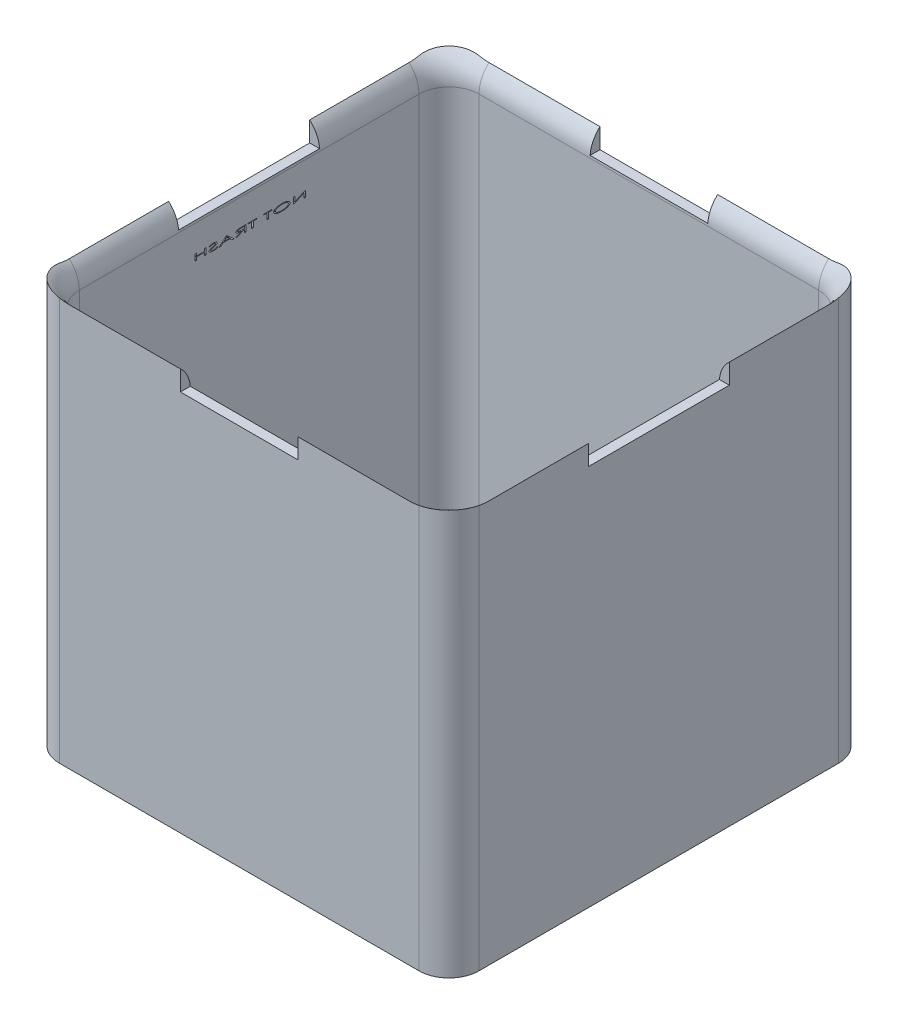
from build123d import *

# Parameters (mm, degrees)
SKETCH1_W           = 200
SKETCH1_H           = 200
BOSS_EXTRUDE1_DEPTH = 5
BOSS_EXTRUDE2_DEPTH = 205
FILLET1_R           = 15
FILLET2_R           = 15
CUT_EXTRUDE1_DEPTH  = 59
SKETCH5_W           = 70.571311495
SKETCH5_H           = 10
CUT_EXTRUDE2_DEPTH  = 241
SKETCH6_W           = 58.885242749
SKETCH6_H           = 10
CUT_EXTRUDE3_DEPTH  = 241


with BuildPart() as part:
    # Sketch1 → Boss-Extrude1 (new body)
    with BuildSketch(Plane(origin=(0, 0, 0), x_dir=(1, 0, 0), z_dir=(0, 1, 0))):
        Polygon((-75.900692841, 116.778290993), (-70.900692841, 111.778290993), (-70.900692841, -88.221709007), (-75.900692841, -93.221709007), align=None)
        Polygon((-75.900692841, -93.221709007), (134.099307159, -93.221709007), (129.099307159, -88.221709007), (-70.900692841, -88.221709007), align=None)
        Polygon((-75.900692841, 116.778290993), (134.099307159, 116.778290993), (134.099307159, -93.221709007), (129.099307159, -88.221709007), (129.099307159, 111.778290993), (-70.900692841, 111.778290993), align=None)
        with Locations((29.099307159, 11.778290993)):
            Rectangle(SKETCH1_W, SKETCH1_H)
    extrude(amount=BOSS_EXTRUDE1_DEPTH)

    # Sketch1<3> → Boss-Extrude2 (add)
    with BuildSketch(Plane(origin=(0, 0, 0), x_dir=(1, 0, 0), z_dir=(0, 1, 0))):
        Polygon((-75.900692841, 116.778290993), (-70.900692841, 111.778290993), (-70.900692841, -88.221709007), (-75.900692841, -93.221709007), align=None)
        Polygon((-75.900692841, 116.778290993), (134.099307159, 116.778290993), (134.099307159, -93.221709007), (129.099307159, -88.221709007), (129.099307159, 111.778290993), (-70.900692841, 111.778290993), align=None)
        Polygon((-75.900692841, -93.221709007), (134.099307159, -93.221709007), (129.099307159, -88.221709007), (-70.900692841, -88.221709007), align=None)
    extrude(amount=BOSS_EXTRUDE2_DEPTH)

    # Fillet1
    fillet1_edges = [part.edges().sort_by_distance(p)[0] for p in [
        (129.099307159, 105, -111.778290993),
        (129.099307159, 105, 88.221709007),
        (-70.900692841, 105, 88.221709007),
        (-70.900692841, 105, -111.778290993),
        (-75.900692841, 102.5, 93.221709007),
        (-75.900692841, 102.5, -116.778290993),
        (134.099307159, 102.5, -116.778290993),
        (134.099307159, 102.5, 93.221709007),
    ]]
    fillet(fillet1_edges, radius=FILLET1_R)

    # Fillet2
    # the kernel refuses this fillet: 15 mm, written as the material it takes off along each edge
    with BuildSketch(Plane(origin=(-55.900692841, 205, -96.778290993), x_dir=(0, 0, -1), z_dir=(1, 0, 0))) as fillet2_piece_1:
        with BuildLine():
            CenterArc((15 + FILLET2_R, -FILLET2_R), FILLET2_R, 90, 90)
            Line((15, -FILLET2_R), (15, 0))
            Line((15, 0), (15 + FILLET2_R, 0))
        make_face()
    revolve(axis=Axis((-55.900692841, 205, -96.778290993), (0, 1, 0)), revolution_arc=90, mode=Mode.SUBTRACT)
    with BuildSketch(Plane(origin=(114.099307159, 205, -111.778290993), x_dir=(0, 0, -1), z_dir=(-1, 0, 0)), Plane(origin=(129.099307159, 205, 73.221709007), x_dir=(1, 0, 0), z_dir=(0, 0, -1)), Plane(origin=(-70.900692841, 205, -96.778290993), x_dir=(-1, 0, 0), z_dir=(0, 0, 1))) as fillet2_piece_2:
        with BuildLine():
            CenterArc((FILLET2_R, FILLET2_R), FILLET2_R, 180, 90)
            Line((0, FILLET2_R), (0, 0))
            Line((0, 0), (FILLET2_R, 0))
        make_face()
    extrude(amount=170, mode=Mode.SUBTRACT)
    with BuildSketch(Plane(origin=(114.099307159, 205, -96.778290993), x_dir=(0, 0, -1), z_dir=(-1, 0, 0))) as fillet2_piece_3:
        with BuildLine():
            CenterArc((15 + FILLET2_R, FILLET2_R), FILLET2_R, 180, 90)
            Line((15, FILLET2_R), (15, 0))
            Line((15, 0), (15 + FILLET2_R, 0))
        make_face()
    revolve(axis=Axis((114.099307159, 205, -96.778290993), (0, -1, 0)), revolution_arc=90, mode=Mode.SUBTRACT)
    with BuildSketch(Plane(origin=(114.099307159, 205, 73.221709007), x_dir=(1, 0, 0), z_dir=(0, 0, -1))) as fillet2_piece_4:
        with BuildLine():
            CenterArc((15 + FILLET2_R, FILLET2_R), FILLET2_R, 180, 90)
            Line((15, FILLET2_R), (15, 0))
            Line((15, 0), (15 + FILLET2_R, 0))
        make_face()
    revolve(axis=Axis((114.099307159, 205, 73.221709007), (0, -1, 0)), revolution_arc=90, mode=Mode.SUBTRACT)
    with BuildSketch(Plane(origin=(114.099307159, 205, 88.221709007), x_dir=(0, 0, 1), z_dir=(-1, 0, 0))) as fillet2_piece_5:
        with BuildLine():
            CenterArc((FILLET2_R, -FILLET2_R), FILLET2_R, 90, 90)
            Line((0, -FILLET2_R), (0, 0))
            Line((0, 0), (FILLET2_R, 0))
        make_face()
    extrude(amount=170, mode=Mode.SUBTRACT)
    with BuildSketch(Plane(origin=(-55.900692841, 205, 73.221709007), x_dir=(0, 0, 1), z_dir=(1, 0, 0))) as fillet2_piece_6:
        with BuildLine():
            CenterArc((15 + FILLET2_R, FILLET2_R), FILLET2_R, 180, 90)
            Line((15, FILLET2_R), (15, 0))
            Line((15, 0), (15 + FILLET2_R, 0))
        make_face()
    revolve(axis=Axis((-55.900692841, 205, 73.221709007), (0, -1, 0)), revolution_arc=90, mode=Mode.SUBTRACT)

    # Sketch3 → Cut-Extrude1 (cut)
    # profile 1 of 8: a face of its own
    with BuildSketch(Plane.ZY.offset(75.900692841)):
        Polygon((-40.001857897, 173.592317805), (-40.001857897, 176.767317805), (-39.839037385, 176.767317805), (-34.628780974, 174.348542765), (-34.628780974, 176.767317805), (-33.855383538, 176.767317805), (-33.855383538, 173.592317805), (-34.031560422, 173.592317805), (-39.228460462, 176.004732669), (-39.228460462, 173.592317805), align=None)
    # profile 2 of 8: a face of its own
    with BuildSketch(Plane.ZY.offset(75.900692841)):
        with BuildLine():
            add(Edge.make_bspline(
                [(-28.206910982, 176.848728062), (-28.133765571, 176.848362168), (-27.988936169, 176.847637692), (-27.774131042, 176.841849515), (-27.563815377, 176.832059611), (-27.35806877, 176.819864911), (-27.15685382, 176.80248585), (-26.960116158, 176.781342181), (-26.767728325, 176.75744085), (-26.579758455, 176.729669701), (-26.396676198, 176.696833279), (-26.217993175, 176.661620999), (-26.043919432, 176.621964097), (-25.874219987, 176.578845755), (-25.708943301, 176.531938234), (-25.548249957, 176.480799304), (-25.392014548, 176.426431484), (-25.241309619, 176.368032014), (-25.097384802, 176.307409836), (-24.962068632, 176.244546513), (-24.835706384, 176.180296306), (-24.718682132, 176.114579652), (-24.611357936, 176.04625388), (-24.513385999, 175.97626215), (-24.423899021, 175.90528829), (-24.344106923, 175.832037768), (-24.273676004, 175.756952951), (-24.213179309, 175.679668479), (-24.161019899, 175.601330054), (-24.118707299, 175.520800668), (-24.086124085, 175.43820001), (-24.062465517, 175.354080034), (-24.047832536, 175.26810063), (-24.04624529, 175.210191359), (-24.045447641, 175.18108984)],
                knots=[0, 0, 0, 0, 1.460257546, 2.891339648, 4.289497073, 5.663427684, 7.005761575, 8.321032018, 9.613516541, 10.875907203, 12.113823443, 13.326535202, 14.511422874, 15.677566445, 16.821712134, 17.940750455, 19.043729357, 20.123697942, 21.166853829, 22.160988997, 23.101750196, 23.996314662, 24.839341628, 25.640341572, 26.399170546, 27.118067848, 27.800848129, 28.451961142, 29.075299312, 29.677322686, 30.264432108, 30.844651183, 31.419395126, 32, 32, 32, 32], degree=3))
            add(Edge.make_bspline(
                [(-24.045447641, 175.18108984), (-24.046245389, 175.152200016), (-24.047832842, 175.094711589), (-24.062465784, 175.009362743), (-24.086136445, 174.925883691), (-24.118685349, 174.843890054), (-24.161237029, 174.763945397), (-24.212921744, 174.685699443), (-24.273951602, 174.609253563), (-24.343350697, 174.533636679), (-24.423513471, 174.461058153), (-24.511681994, 174.38868647), (-24.610564438, 174.320009623), (-24.716998723, 174.250698076), (-24.834290984, 174.18518121), (-24.959641662, 174.119384267), (-25.09515935, 174.05670368), (-25.238586221, 173.995543993), (-25.388510319, 173.936315283), (-25.543930561, 173.882231768), (-25.702883414, 173.830090508), (-25.866503577, 173.783623079), (-26.033711266, 173.739534124), (-26.204989358, 173.699226279), (-26.380768462, 173.664058623), (-26.560521087, 173.631422168), (-26.744408455, 173.602972876), (-26.932029793, 173.577902527), (-27.123825406, 173.558003568), (-27.319712341, 173.540578418), (-27.519900545, 173.527352395), (-27.724099985, 173.517873056), (-27.932328356, 173.5119768), (-28.072495376, 173.511266434), (-28.14330922, 173.510907549)],
                knots=[0, 0, 0, 0, 0.584140325, 1.162392244, 1.746296282, 2.337325662, 2.9436603, 3.575393273, 4.231906634, 4.920964509, 5.649543557, 6.417945807, 7.227247536, 8.083939908, 8.98682013, 9.944179777, 10.947815242, 12.006697977, 13.098770757, 14.208509301, 15.335759188, 16.482942188, 17.649252518, 18.8343427, 20.042360184, 21.275834938, 22.530430142, 23.806834395, 25.10524114, 26.431464932, 27.785647702, 29.164070497, 30.567258786, 32, 32, 32, 32], degree=3))
            add(Edge.make_bspline(
                [(-28.14330922, 173.510907549), (-28.214971193, 173.511265208), (-28.356834189, 173.511973234), (-28.567392176, 173.517883303), (-28.773720738, 173.527266784), (-28.975973294, 173.540910983), (-29.174113355, 173.556887517), (-29.367898731, 173.578133295), (-29.557207493, 173.603073881), (-29.742695129, 173.630590605), (-29.923642789, 173.663494039), (-30.10072405, 173.698513375), (-30.273141431, 173.739127501), (-30.441659401, 173.782048362), (-30.605969554, 173.828899551), (-30.765604453, 173.880895442), (-30.92149669, 173.93519563), (-31.072033337, 173.993489555), (-31.21590786, 174.054207107), (-31.351482988, 174.116785155), (-31.477246931, 174.182159705), (-31.594873954, 174.246777732), (-31.701767323, 174.315387595), (-31.799900058, 174.384660489), (-31.889462863, 174.454706244), (-31.968346804, 174.528024566), (-32.039684888, 174.601124873), (-32.100075705, 174.677449405), (-32.152312114, 174.754449417), (-32.194446594, 174.833578985), (-32.227214692, 174.914399476), (-32.250852883, 174.996631413), (-32.265500695, 175.080710251), (-32.267086588, 175.137358352), (-32.267883538, 175.165825417)],
                knots=[0, 0, 0, 0, 1.445325035, 2.861184648, 4.248073488, 5.610784469, 6.949502363, 8.257024759, 9.542121152, 10.800563395, 12.038564666, 13.251154028, 14.440834281, 15.610669576, 16.758343651, 17.88610641, 18.996378223, 20.087438883, 21.141308751, 22.14565442, 23.098028525, 23.999684505, 24.85136998, 25.658118948, 26.422077793, 27.142316893, 27.828828533, 28.479923945, 29.102539741, 29.70318392, 30.284413152, 30.85825019, 31.426242623, 32, 32, 32, 32], degree=3))
            add(Edge.make_bspline(
                [(-32.267883538, 175.165825417), (-32.266339268, 175.203705852), (-32.263241734, 175.279687274), (-32.236378738, 175.392223854), (-32.193311188, 175.502615232), (-32.132667494, 175.610505421), (-32.055366403, 175.716141699), (-31.960978873, 175.819325721), (-31.849825402, 175.920313148), (-31.722310139, 176.018457974), (-31.580594465, 176.113231395), (-31.425433081, 176.202710306), (-31.258497681, 176.287553491), (-31.078625954, 176.366131833), (-30.886638945, 176.439581562), (-30.682531133, 176.508334118), (-30.46617592, 176.571990459), (-30.238318571, 176.628939329), (-30.002204012, 176.681344925), (-29.759773105, 176.725252892), (-29.512770922, 176.763762224), (-29.260976855, 176.794709639), (-29.004350379, 176.818999832), (-28.742819447, 176.835719415), (-28.476474897, 176.847287853), (-28.297238046, 176.848245468), (-28.206910982, 176.848728062)],
                knots=[0, 0, 0, 0, 0.578067953, 1.159501633, 1.757374589, 2.383731834, 3.044548284, 3.753078388, 4.516515232, 5.33607101, 6.209241863, 7.119207043, 8.070889664, 9.068674338, 10.116512201, 11.210413206, 12.358298633, 13.560994822, 14.797971198, 16.052664677, 17.324313034, 18.616717473, 19.927802692, 21.261878947, 22.62011392, 24, 24, 24, 24], degree=3))
        make_face()
        with BuildLine():
            add(Edge.make_bspline(
                [(-28.17256603, 176.523087036), (-28.244234801, 176.522722217), (-28.386569579, 176.521997684), (-28.598414038, 176.512400892), (-28.807333242, 176.498696271), (-29.013551434, 176.479198345), (-29.217057007, 176.452706349), (-29.417988536, 176.4218745), (-29.615896657, 176.384985915), (-29.809456411, 176.342400286), (-29.99655126, 176.296161022), (-30.174062866, 176.244573486), (-30.341056798, 176.189269817), (-30.497589664, 176.130407892), (-30.643589922, 176.06731745), (-30.779409408, 176.000932667), (-30.904252589, 175.929648418), (-31.017928672, 175.854889749), (-31.120017129, 175.777682217), (-31.209061252, 175.697693422), (-31.283995335, 175.614663376), (-31.345691474, 175.529741695), (-31.394456083, 175.442690857), (-31.428176455, 175.352810744), (-31.449693728, 175.260753852), (-31.45241586, 175.198378095), (-31.453780974, 175.167097453)],
                knots=[0, 0, 0, 0, 1.355253351, 2.691544493, 4.009564301, 5.314524347, 6.608002531, 7.890096637, 9.158501436, 10.414425018, 11.637715397, 12.802511071, 13.909358877, 14.963786005, 15.964051182, 16.916167109, 17.821249446, 18.680830851, 19.487536482, 20.239724141, 20.940946927, 21.598589437, 22.221278208, 22.821462491, 23.40897855, 24, 24, 24, 24], degree=3))
            add(Edge.make_bspline(
                [(-31.453780974, 175.167097453), (-31.453067114, 175.143937478), (-31.451643718, 175.097757882), (-31.439554453, 175.029588335), (-31.421254335, 174.962440772), (-31.394163665, 174.897221598), (-31.360316378, 174.832961239), (-31.318244575, 174.770711201), (-31.270434479, 174.708489062), (-31.212705423, 174.649765814), (-31.149173069, 174.590685823), (-31.077249588, 174.533884455), (-30.997766438, 174.478486143), (-30.911560923, 174.423857927), (-30.817467773, 174.370901238), (-30.715827674, 174.319779047), (-30.60683314, 174.26941327), (-30.450405169, 174.203749058), (-30.243712587, 174.128481661), (-29.984224298, 174.050202753), (-29.712399354, 173.984253484), (-29.428087613, 173.93056373), (-29.131686506, 173.887662246), (-28.822818817, 173.858691406), (-28.501848491, 173.839296267), (-28.283686937, 173.837475821), (-28.17256603, 173.836548574)],
                knots=[0, 0, 0, 0, 0.43913289, 0.875604568, 1.309920634, 1.757376291, 2.212647419, 2.685698332, 3.181399445, 3.6992134, 4.245820656, 4.826937302, 5.436272867, 6.083557499, 6.76263554, 7.484037418, 8.241771013, 9.040427068, 10.702459269, 12.412810423, 14.18069632, 16.00709122, 17.900923286, 19.861049113, 21.891819303, 24, 24, 24, 24], degree=3))
            add(Edge.make_bspline(
                [(-28.17256603, 173.836548574), (-28.097720115, 173.836980442), (-27.94946543, 173.837835885), (-27.729112345, 173.846393295), (-27.512987708, 173.860194292), (-27.30113908, 173.88002268), (-27.093532928, 173.904922625), (-26.889971396, 173.934268956), (-26.690952152, 173.970981023), (-26.496975183, 174.011805888), (-26.310557999, 174.058011704), (-26.133272699, 174.108011052), (-25.966731514, 174.162635428), (-25.810709697, 174.221055637), (-25.665236496, 174.28307434), (-25.530810345, 174.350133549), (-25.406366399, 174.420360448), (-25.293247598, 174.495135928), (-25.192190459, 174.5732922), (-25.103134668, 174.65275577), (-25.02862377, 174.735732743), (-24.966764645, 174.820124607), (-24.919415384, 174.907608942), (-24.883963117, 174.99654632), (-24.863968471, 175.088620985), (-24.86102327, 175.150684382), (-24.859550205, 175.181725858)],
                knots=[0, 0, 0, 0, 1.404568691, 2.782167699, 4.137752154, 5.468385467, 6.774687898, 8.061528997, 9.327341186, 10.571985394, 11.781102187, 12.930971912, 14.028110404, 15.069350324, 16.056739696, 16.994445907, 17.887181568, 18.73687236, 19.536678664, 20.283115772, 20.973358758, 21.625973524, 22.241990289, 22.835295955, 23.417464493, 24, 24, 24, 24], degree=3))
            add(Edge.make_bspline(
                [(-24.859550205, 175.181725858), (-24.861023729, 175.21255565), (-24.863970045, 175.274199922), (-24.883963503, 175.365651337), (-24.919448894, 175.453932956), (-24.966616048, 175.540705759), (-25.028690831, 175.623908458), (-25.10318744, 175.705619648), (-25.192245532, 175.783790125), (-25.293284785, 175.860701309), (-25.406702115, 175.934253809), (-25.531583128, 176.003984215), (-25.667344244, 176.070036223), (-25.814042497, 176.132390584), (-25.971843442, 176.190627881), (-26.140567124, 176.245205978), (-26.320266685, 176.296077255), (-26.50979056, 176.342523446), (-26.706156363, 176.384889499), (-26.906794915, 176.421883329), (-27.110477123, 176.452755993), (-27.316959197, 176.479188106), (-27.526563771, 176.49872795), (-27.739088842, 176.512394231), (-27.954747846, 176.521998472), (-28.099625377, 176.522722509), (-28.17256603, 176.523087036)],
                knots=[0, 0, 0, 0, 0.579626187, 1.158964491, 1.74964148, 2.363286508, 3.010647586, 3.69624579, 4.438717393, 5.23513349, 6.081999422, 6.97787637, 7.922685491, 8.919209554, 9.973556671, 11.084069299, 12.252468167, 13.484100248, 14.752177165, 16.028863714, 17.319240668, 18.624948134, 19.942140427, 21.276338886, 22.628734072, 24, 24, 24, 24], degree=3))
        make_face(mode=Mode.SUBTRACT)
    # profile 3 of 8: a face of its own
    with BuildSketch(Plane.ZY.offset(75.900692841)):
        Polygon((-23.231345077, 176.44167678), (-23.231345077, 176.767317805), (-18.957306615, 176.767317805), (-18.957306615, 176.44167678), (-20.707627128, 176.44167678), (-20.707627128, 173.592317805), (-21.481024564, 173.592317805), (-21.481024564, 176.44167678), align=None)
    # profile 4 of 8: a face of its own
    with BuildSketch(Plane.ZY.offset(75.900692841)):
        Polygon((-15.578780974, 176.44167678), (-15.578780974, 176.767317805), (-11.304742513, 176.767317805), (-11.304742513, 176.44167678), (-13.055063026, 176.44167678), (-13.055063026, 173.592317805), (-13.828460462, 173.592317805), (-13.828460462, 176.44167678), align=None)
    # profile 5 of 8: a face of its own
    with BuildSketch(Plane.ZY.offset(75.900692841)):
        with BuildLine():
            Line((-10.124293795, 176.767317805), (-8.555874324, 176.767317805))
            add(Edge.make_bspline(
                [(-8.555874324, 176.767317805), (-8.502236697, 176.767381524), (-8.397293076, 176.767506192), (-8.243165871, 176.766614578), (-8.095819387, 176.766209253), (-7.955044995, 176.764944161), (-7.820849528, 176.762890368), (-7.693222131, 176.760980294), (-7.572159863, 176.759236075), (-7.457672561, 176.756722696), (-7.349770068, 176.753413993), (-7.248431969, 176.750213235), (-7.153862281, 176.747220766), (-7.065870762, 176.743457989), (-6.984692607, 176.738812485), (-6.91003274, 176.734632848), (-6.841999349, 176.729396164), (-6.798767749, 176.725785828), (-6.778205053, 176.724068607)],
                knots=[0, 0, 0, 0, 1.447513378, 2.832103213, 4.15947959, 5.423960048, 6.631296777, 7.781425608, 8.868626489, 9.898732157, 10.871790205, 11.781941973, 12.634909937, 13.425208605, 14.158641683, 14.829242103, 15.443140243, 16, 16, 16, 16], degree=3))
            add(Edge.make_bspline(
                [(-6.778205053, 176.724068607), (-6.721124712, 176.718352826), (-6.609265508, 176.707151724), (-6.446163629, 176.683431756), (-6.291096306, 176.65542891), (-6.144288906, 176.623508541), (-6.005814662, 176.585688445), (-5.875421826, 176.543921039), (-5.752872235, 176.497777663), (-5.639868527, 176.446377425), (-5.53675879, 176.392866069), (-5.447381041, 176.334299386), (-5.371375699, 176.2728564), (-5.308022632, 176.20903522), (-5.259717756, 176.140666468), (-5.224226685, 176.0697148), (-5.203175821, 175.994898635), (-5.200374788, 175.943801099), (-5.198973282, 175.918234272)],
                knots=[0, 0, 0, 0, 1.446424159, 2.834528544, 4.15474672, 5.419427177, 6.621638102, 7.772979837, 8.871111456, 9.921473686, 10.902006625, 11.797596097, 12.61083074, 13.36318367, 14.057369682, 14.712475299, 15.355782592, 16, 16, 16, 16], degree=3))
            add(Edge.make_bspline(
                [(-5.198973282, 175.918234272), (-5.199696556, 175.896724754), (-5.201138965, 175.853828834), (-5.216970136, 175.791013206), (-5.240098663, 175.729741224), (-5.275090197, 175.671642577), (-5.317574273, 175.614618101), (-5.370836735, 175.560287453), (-5.433075461, 175.507801657), (-5.504699552, 175.457568874), (-5.585049424, 175.410139625), (-5.673544721, 175.364931367), (-5.770494089, 175.323119345), (-5.875613678, 175.284350665), (-5.988930044, 175.24917066), (-6.110144211, 175.215755947), (-6.239667313, 175.186297465), (-6.378124602, 175.159240343), (-6.527317361, 175.135989333), (-6.689052996, 175.114644897), (-6.864352006, 175.098249119), (-7.053031585, 175.083340753), (-7.255132265, 175.072153051), (-7.470985905, 175.063983242), (-7.700194252, 175.058867165), (-7.857524275, 175.058097556), (-7.938301207, 175.057702421)],
                knots=[0, 0, 0, 0, 0.503317736, 1.003754633, 1.510595538, 2.034130965, 2.587947849, 3.175101599, 3.813556362, 4.494930901, 5.22390086, 5.99985628, 6.823672935, 7.698218743, 8.625891248, 9.60519755, 10.645935196, 11.739873159, 12.912727555, 14.186080425, 15.56474174, 17.04071722, 18.624158805, 20.310708322, 22.105830933, 24, 24, 24, 24], degree=3))
            Line((-7.938301207, 175.057702421), (-5.117563026, 173.592317805))
            Line((-5.117563026, 173.592317805), (-6.095758138, 173.592317805))
            Line((-6.095758138, 173.592317805), (-8.917132337, 175.057702421))
            Line((-8.917132337, 175.057702421), (-9.350896359, 175.057702421))
            Line((-9.350896359, 175.057702421), (-9.350896359, 173.592317805))
            Line((-9.350896359, 173.592317805), (-10.124293795, 173.592317805))
            Line((-10.124293795, 173.592317805), (-10.124293795, 176.767317805))
        make_face()
        with BuildLine():
            Line((-9.350896359, 176.44167678), (-9.350896359, 175.383343446))
            Line((-9.350896359, 175.383343446), (-7.988546599, 175.378891323))
            add(Edge.make_bspline(
                [(-7.988546599, 175.378891323), (-7.924730669, 175.378877111), (-7.801329967, 175.378849628), (-7.622821287, 175.382481444), (-7.457219799, 175.386577143), (-7.304553107, 175.392903457), (-7.164596942, 175.401042179), (-7.037559825, 175.411059254), (-6.923430315, 175.422949647), (-6.821, 175.437101708), (-6.727412022, 175.453039856), (-6.64028899, 175.471609639), (-6.558345119, 175.491755687), (-6.481473217, 175.514073437), (-6.409797426, 175.538555843), (-6.343598567, 175.565915266), (-6.28276125, 175.595433585), (-6.226863401, 175.626233895), (-6.176724286, 175.658981104), (-6.13330729, 175.693285686), (-6.096679619, 175.728465686), (-6.066296409, 175.764267967), (-6.042201102, 175.801265974), (-6.025779861, 175.839855789), (-6.0147539, 175.879039331), (-6.013632625, 175.905654365), (-6.013075846, 175.918870289)],
                knots=[0, 0, 0, 0, 2.1119765, 4.083923552, 5.908873173, 7.594292989, 9.140614403, 10.548396697, 11.811404688, 12.937655877, 13.970058596, 14.952618383, 15.88517887, 16.762240683, 17.600997965, 18.390626413, 19.131223972, 19.837942073, 20.501548161, 21.110812644, 21.666579248, 22.179551701, 22.662264086, 23.121080597, 23.563565018, 24, 24, 24, 24], degree=3))
            add(Edge.make_bspline(
                [(-6.013075846, 175.918870289), (-6.013632655, 175.931871168), (-6.014745605, 175.957857298), (-6.025626137, 175.996182387), (-6.043185027, 176.033280882), (-6.066910369, 176.069671466), (-6.097426273, 176.105199454), (-6.135093659, 176.139167507), (-6.179395628, 176.17219916), (-6.2295578, 176.204478389), (-6.285017058, 176.235246493), (-6.345070127, 176.264055318), (-6.409602393, 176.289880877), (-6.47823895, 176.31425671), (-6.551436554, 176.335456003), (-6.628536475, 176.355470084), (-6.709860079, 176.372403884), (-6.797027962, 176.387402363), (-6.89337254, 176.400031884), (-7.002567011, 176.41155204), (-7.126229562, 176.420822545), (-7.264502432, 176.428175037), (-7.416936314, 176.434651351), (-7.584018234, 176.438933361), (-7.765508099, 176.441488711), (-7.891446983, 176.441612563), (-7.956745718, 176.44167678)],
                knots=[0, 0, 0, 0, 0.437359585, 0.874193462, 1.331361263, 1.816964671, 2.333942147, 2.905477287, 3.522881613, 4.194820874, 4.914569407, 5.659283665, 6.438215648, 7.256346892, 8.113284703, 9.005860074, 9.940658209, 10.912206718, 11.986489438, 13.215183343, 14.612743407, 16.165765119, 17.882260618, 19.755145155, 21.799062208, 24, 24, 24, 24], degree=3))
            Line((-7.956745718, 176.44167678), (-9.350896359, 176.44167678))
        make_face(mode=Mode.SUBTRACT)
    # profile 6 of 8: a face of its own
    with BuildSketch(Plane.ZY.offset(75.900692841)):
        Polygon((-0.355063026, 176.767317805), (3.308398513, 173.592317805), (2.455498873, 173.592317805), (1.281410332, 174.60994601), (-2.220502729, 174.60994601), (-3.407947641, 173.592317805), (-4.262755333, 173.592317805), (-0.558588667, 176.767317805), align=None)
        Polygon((-0.460005934, 176.119215842), (-1.841436223, 174.935587036), (0.905523913, 174.935587036), align=None, mode=Mode.SUBTRACT)
    # profile 7 of 8: a face of its own
    with BuildSketch(Plane.ZY.offset(75.900692841)):
        with BuildLine():
            Line((3.715449795, 174.204802781), (4.381360252, 174.365715241))
            add(Edge.make_bspline(
                [(4.381360252, 174.365715241), (4.441309432, 174.3233197), (4.56043963, 174.239071857), (4.750492741, 174.131891232), (4.946753687, 174.040571541), (5.150075206, 173.965704976), (5.360331859, 173.907910602), (5.577676903, 173.866627315), (5.801827819, 173.841183025), (5.953740821, 173.838104963), (6.030553962, 173.836548574)],
                knots=[0, 0, 0, 0, 0.999301894, 1.985799148, 2.966122564, 3.944318318, 4.932550154, 5.931868728, 6.954272153, 8, 8, 8, 8], degree=3))
            add(Edge.make_bspline(
                [(6.030553962, 173.836548574), (6.096303441, 173.837312923), (6.225836051, 173.838818762), (6.416856456, 173.853433574), (6.601853864, 173.875832997), (6.751067785, 173.903198063), (6.865582967, 173.928537558), (6.945799775, 173.949473884), (7.020664501, 173.972291319), (7.090223817, 173.996554694), (7.154750335, 174.021726244), (7.213816973, 174.049258801), (7.268156213, 174.077452422), (7.316591187, 174.108258169), (7.359590769, 174.13963053), (7.396980273, 174.171800702), (7.428990428, 174.204089651), (7.455336685, 174.236982917), (7.475290057, 174.270737423), (7.490503099, 174.304456566), (7.498842568, 174.339456876), (7.500300054, 174.362920928), (7.501026718, 174.374619488)],
                knots=[0, 0, 0, 0, 2.367074415, 4.663357471, 6.89414542, 9.07428078, 10.122529426, 11.116827178, 12.058601515, 12.939798767, 13.76907445, 14.551229421, 15.285422679, 15.971613976, 16.615933781, 17.200503758, 17.745717994, 18.251221677, 18.713364822, 19.154409607, 19.578410831, 20, 20, 20, 20], degree=3))
            add(Edge.make_bspline(
                [(7.501026718, 174.374619488), (7.500095683, 174.387861708), (7.498192548, 174.414930237), (7.484491949, 174.455003084), (7.463050374, 174.494778939), (7.433370552, 174.534497279), (7.394675513, 174.573409082), (7.346915736, 174.610946413), (7.292361921, 174.650429971), (7.251528186, 174.673927658), (7.230083208, 174.686268126)],
                knots=[0, 0, 0, 0, 0.736359725, 1.505198915, 2.334101288, 3.245211585, 4.255006149, 5.379339436, 6.623686787, 8, 8, 8, 8], degree=3))
            add(Edge.make_bspline(
                [(7.230083208, 174.686268126), (7.213818092, 174.69528429), (7.179888177, 174.714092498), (7.125840382, 174.741108404), (7.067181181, 174.769262105), (7.003528474, 174.797816717), (6.934968006, 174.826905062), (6.861823622, 174.856813582), (6.78373684, 174.887392239), (6.70100609, 174.919225747), (6.613057744, 174.950775546), (6.520699332, 174.983442777), (6.423216835, 175.016231284), (6.321266907, 175.050877117), (6.213941103, 175.084846592), (6.102453396, 175.120804479), (5.985624311, 175.156126937), (5.906315206, 175.180231841), (5.865825396, 175.192538158)],
                knots=[0, 0, 0, 0, 0.612393141, 1.277485318, 1.989516678, 2.755157347, 3.574766992, 4.44217155, 5.357538282, 6.336544056, 7.361359407, 8.434551716, 9.562815989, 10.748468678, 11.980556757, 13.270100396, 14.606299784, 16, 16, 16, 16], degree=3))
            add(Edge.make_bspline(
                [(5.865825396, 175.192538158), (5.825343321, 175.204870873), (5.746302404, 175.228950398), (5.630321889, 175.263617601), (5.520558718, 175.297948432), (5.416856156, 175.331372999), (5.318609828, 175.362040055), (5.226699815, 175.393099112), (5.140035829, 175.421031121), (5.060046175, 175.449646149), (4.985288205, 175.475187931), (4.916894498, 175.501027936), (4.853752386, 175.524308272), (4.79670026, 175.54652455), (4.745410268, 175.56731934), (4.70057748, 175.587996052), (4.66098344, 175.605912794), (4.637197426, 175.618560745), (4.626227038, 175.624394127)],
                knots=[0, 0, 0, 0, 1.545897092, 3.018351337, 4.421902659, 5.746937448, 6.998507922, 8.181390747, 9.290802915, 10.324396982, 11.284528217, 12.176458524, 12.994961478, 13.742817654, 14.413019439, 15.01614685, 15.546235448, 16, 16, 16, 16], degree=3))
            add(Edge.make_bspline(
                [(4.626227038, 175.624394127), (4.592834237, 175.64273597), (4.529429448, 175.677562656), (4.44359691, 175.735585986), (4.369480827, 175.79316226), (4.31042928, 175.85422707), (4.262004111, 175.914580279), (4.229681912, 175.978182741), (4.207354221, 176.042258805), (4.205045915, 176.086179537), (4.203911333, 176.107767525)],
                knots=[0, 0, 0, 0, 1.358038866, 2.578584679, 3.692160972, 4.697396056, 5.603309455, 6.438660662, 7.232567997, 8, 8, 8, 8], degree=3))
            add(Edge.make_bspline(
                [(4.203911333, 176.107767525), (4.204563109, 176.124812624), (4.205867115, 176.158914736), (4.219125661, 176.209035157), (4.237859015, 176.258605041), (4.26594055, 176.306417785), (4.301191813, 176.353318026), (4.344900148, 176.398116903), (4.395675622, 176.442428407), (4.454024623, 176.485281054), (4.519491391, 176.526493461), (4.591850062, 176.565349271), (4.670618205, 176.601778901), (4.75519518, 176.637205383), (4.846587231, 176.668532889), (4.943948593, 176.698439513), (5.047623917, 176.726476831), (5.195708958, 176.760458008), (5.389757257, 176.795756634), (5.631042623, 176.827306909), (5.88231186, 176.84482952), (6.053000857, 176.84741237), (6.139948994, 176.848728062)],
                knots=[0, 0, 0, 0, 0.460405938, 0.921133675, 1.395388169, 1.891534112, 2.41607595, 2.980276919, 3.582238422, 4.238791046, 4.937766679, 5.674725507, 6.460354842, 7.286326003, 8.155716285, 9.074272011, 10.043204283, 11.062236692, 13.186309529, 15.379476941, 17.646328254, 20, 20, 20, 20], degree=3))
            add(Edge.make_bspline(
                [(6.139948994, 176.848728062), (6.232425332, 176.84746541), (6.414670058, 176.84497708), (6.683544868, 176.822864112), (6.943205092, 176.78662484), (7.154128684, 176.745058701), (7.319967661, 176.702176149), (7.445740905, 176.664948271), (7.572878639, 176.620750528), (7.701889057, 176.570982566), (7.832493499, 176.515032638), (7.965120196, 176.453212613), (8.099284748, 176.385126131), (8.188484053, 176.336136771), (8.233719026, 176.311293166)],
                knots=[0, 0, 0, 0, 1.521020812, 2.997502144, 4.434208615, 5.832201361, 6.530880114, 7.25140359, 7.98924051, 8.744404629, 9.525629069, 10.32602435, 11.151089316, 12, 12, 12, 12], degree=3))
            Line((8.233719026, 176.311293166), (7.594521309, 176.116035754))
            add(Edge.make_bspline(
                [(7.594521309, 176.116035754), (7.557541365, 176.136195405), (7.48534552, 176.175553037), (7.377733922, 176.229249114), (7.274907846, 176.27853298), (7.176001005, 176.321873313), (7.08139402, 176.360033975), (6.990876896, 176.393284606), (6.904646711, 176.421533664), (6.794150433, 176.451148775), (6.655491252, 176.480822348), (6.484217461, 176.505311532), (6.305788188, 176.520126424), (6.184498951, 176.522088541), (6.122776518, 176.523087036)],
                knots=[0, 0, 0, 0, 0.980337606, 1.913910424, 2.799102258, 3.634409705, 4.427111586, 5.173398302, 5.87881715, 6.53845457, 7.835481288, 9.17688944, 10.563357661, 12, 12, 12, 12], degree=3))
            add(Edge.make_bspline(
                [(6.122776518, 176.523087036), (6.083127955, 176.522660668), (6.005705812, 176.521828095), (5.892162279, 176.51708753), (5.784423102, 176.507361697), (5.682184631, 176.49459843), (5.585237475, 176.479193596), (5.494066461, 176.458669679), (5.408190178, 176.435270534), (5.328768069, 176.408218936), (5.256799812, 176.378603425), (5.193429286, 176.347934277), (5.139984979, 176.314825422), (5.096099009, 176.279650719), (5.061189406, 176.243002733), (5.035977928, 176.204152709), (5.021328591, 176.163045023), (5.019111864, 176.13500994), (5.018013897, 176.121123895)],
                knots=[0, 0, 0, 0, 1.517070092, 2.962397858, 4.346732628, 5.654693746, 6.904227172, 8.100795781, 9.22842913, 10.308373245, 11.30860669, 12.204639, 12.999123415, 13.708554952, 14.351372882, 14.927469995, 15.468765608, 16, 16, 16, 16], degree=3))
            add(Edge.make_bspline(
                [(5.018013897, 176.121123895), (5.019517799, 176.103993344), (5.02260218, 176.068859962), (5.043843737, 176.017089871), (5.078896722, 175.967561473), (5.116761597, 175.926843187), (5.155926155, 175.896125847), (5.19065776, 175.870343741), (5.231680473, 175.845361121), (5.27761877, 175.819119355), (5.32906917, 175.792356157), (5.386717812, 175.766027697), (5.449204506, 175.737816745), (5.493263077, 175.720061597), (5.5160157, 175.710892525)],
                knots=[0, 0, 0, 0, 0.907853707, 1.861934888, 2.922122969, 4.114982742, 4.794473583, 5.559038982, 6.407523186, 7.339014998, 8.364787121, 9.481355444, 10.699327498, 12, 12, 12, 12], degree=3))
            add(Edge.make_bspline(
                [(5.5160157, 175.710892525), (5.523444479, 175.708161264), (5.540002025, 175.702073726), (5.567420906, 175.691297326), (5.601093816, 175.681606096), (5.639286256, 175.667079375), (5.683821907, 175.653986849), (5.733527454, 175.637733112), (5.788782872, 175.619887565), (5.849667299, 175.600925546), (5.916106987, 175.580626392), (5.987858116, 175.558191022), (6.065285221, 175.53480184), (6.148261829, 175.51005948), (6.23653343, 175.483109106), (6.330627792, 175.455499119), (6.42988844, 175.425249857), (6.498011507, 175.405128544), (6.533007888, 175.394791764)],
                knots=[0, 0, 0, 0, 0.356713724, 0.795057133, 1.326833629, 1.934174987, 2.635212013, 3.417771439, 4.290963286, 5.251895696, 6.291490936, 7.421701509, 8.639723694, 9.93644018, 11.323755665, 12.798923915, 14.355533842, 16, 16, 16, 16], degree=3))
            add(Edge.make_bspline(
                [(6.533007888, 175.394791764), (6.574792091, 175.38213342), (6.656749569, 175.357304757), (6.776948224, 175.319740703), (6.892096253, 175.282926779), (7.002271421, 175.2464629), (7.10768105, 175.211353948), (7.207741245, 175.175299301), (7.303005377, 175.140512081), (7.393196078, 175.106363353), (7.478077929, 175.07230599), (7.558294514, 175.039675691), (7.633023801, 175.006262292), (7.703504194, 174.974678419), (7.768567444, 174.942987951), (7.828801524, 174.911969266), (7.883273602, 174.8804076), (7.949075668, 174.841908143), (8.021803252, 174.792437125), (8.09994154, 174.733436971), (8.165257045, 174.672929119), (8.220086281, 174.613784125), (8.262271485, 174.55315655), (8.292511985, 174.492643053), (8.311893708, 174.431552257), (8.314060673, 174.390440886), (8.315129282, 174.370167365)],
                knots=[0, 0, 0, 0, 1.465622365, 2.874739772, 4.227425773, 5.523763526, 6.770588987, 7.956899197, 9.093939721, 10.175152002, 11.194092472, 12.164191172, 13.081917256, 13.941859919, 14.756710256, 15.511139054, 16.215571939, 16.869788332, 18.069915647, 19.166016233, 20.153194536, 21.055138089, 21.868495227, 22.622823312, 23.320863784, 24, 24, 24, 24], degree=3))
            add(Edge.make_bspline(
                [(8.315129282, 174.370167365), (8.314659516, 174.355713956), (8.313727126, 174.327026857), (8.305568505, 174.284367278), (8.293040806, 174.242468109), (8.274858212, 174.201391299), (8.251818561, 174.161122864), (8.223533927, 174.121828698), (8.190986795, 174.082535475), (8.152547916, 174.044596576), (8.109147627, 174.007082907), (8.060888185, 173.970073997), (8.006982405, 173.934932651), (7.949235017, 173.898696943), (7.885371684, 173.864802498), (7.816801427, 173.831207207), (7.743288695, 173.797899361), (7.637602469, 173.754593625), (7.4976953, 173.704611393), (7.322133742, 173.652499671), (7.137828556, 173.608629516), (6.94458715, 173.573243921), (6.742537791, 173.545482456), (6.531861436, 173.525188409), (6.31245908, 173.512850101), (6.163285978, 173.511563918), (6.08715953, 173.510907549)],
                knots=[0, 0, 0, 0, 0.408365711, 0.810523548, 1.22396232, 1.642756068, 2.077756279, 2.53353516, 3.010204836, 3.518898733, 4.058616592, 4.631760099, 5.236989457, 5.877558991, 6.558883948, 7.280106935, 8.036738639, 8.84054028, 10.509266481, 12.235372807, 14.016628891, 15.86388167, 17.788458921, 19.782060598, 21.847489026, 24, 24, 24, 24], degree=3))
            add(Edge.make_bspline(
                [(6.08715953, 173.510907549), (6.028211783, 173.511361479), (5.911750228, 173.512258296), (5.739134782, 173.520435727), (5.570428287, 173.531882561), (5.405907745, 173.550136715), (5.245468903, 173.572036599), (5.089344296, 173.599505518), (4.93740448, 173.631793869), (4.789282674, 173.66945275), (4.644507783, 173.712388925), (4.503300349, 173.762937466), (4.364778206, 173.819501433), (4.229355097, 173.883393265), (4.096071467, 173.953255671), (3.965949333, 174.030402755), (3.838162254, 174.113414579), (3.756475283, 174.174249685), (3.715449795, 174.204802781)],
                knots=[0, 0, 0, 0, 1.123519158, 2.219708013, 3.293326598, 4.346048509, 5.37415993, 6.379342228, 7.36688953, 8.334247009, 9.29183175, 10.244046751, 11.191835519, 12.142711933, 13.09711952, 14.059068445, 15.025209738, 16, 16, 16, 16], degree=3))
        make_face()
    # profile 8 of 8: a face of its own
    with BuildSketch(Plane.ZY.offset(75.900692841)):
        Polygon((9.902629282, 176.767317805), (10.676026718, 176.767317805), (10.676026718, 175.464753703), (14.665129282, 175.464753703), (14.665129282, 176.767317805), (15.438526718, 176.767317805), (15.438526718, 173.592317805), (14.665129282, 173.592317805), (14.665129282, 175.139112677), (10.676026718, 175.139112677), (10.676026718, 173.592317805), (9.902629282, 173.592317805), align=None)
    extrude(amount=-CUT_EXTRUDE1_DEPTH, mode=Mode.SUBTRACT)


with BuildPart() as cut_extrude1_piece_1:
    # of the separate pieces the step leaves, piece 1, a body of its own (cut_extrude1_pieces)
    add(part.part.solids().sort_by_distance((-75.900692841, 0, 78.221709007))[0])

    # Sketch5 → Cut-Extrude2 (cut)
    with BuildSketch(Plane(origin=(134.099307159, 0, 0), x_dir=(0, 0, -1), z_dir=(1, 0, 0))):
        with Locations((11.778290994, 196.180339887)):
            Rectangle(SKETCH5_W, SKETCH5_H)
    extrude(amount=-CUT_EXTRUDE2_DEPTH, mode=Mode.SUBTRACT)

    # Sketch6 → Cut-Extrude3 (cut)
    with BuildSketch(Plane(origin=(0, 0, -116.778290993), x_dir=(-1, 0, 0), z_dir=(0, 0, -1))):
        with Locations((-29.09930716, 196.180339887)):
            Rectangle(SKETCH6_W, SKETCH6_H)
    extrude(amount=-CUT_EXTRUDE3_DEPTH, mode=Mode.SUBTRACT)


with BuildPart() as cut_extrude1_piece_2:
    # of the separate pieces the step leaves, piece 2, a body of its own (cut_extrude1_pieces)
    add(part.part.solids().sort_by_distance((-75.900692841, 175.181725858, -24.859550205))[0])


with BuildPart() as cut_extrude1_piece_3:
    # of the separate pieces the step leaves, piece 3, a body of its own (cut_extrude1_pieces)
    add(part.part.solids().sort_by_distance((-75.900692841, 176.44167678, -7.956745718))[0])


with BuildPart() as cut_extrude1_piece_4:
    # of the separate pieces the step leaves, piece 4, a body of its own (cut_extrude1_pieces)
    add(part.part.solids().sort_by_distance((-75.900692841, 174.935587036, 0.905523913))[0])


solid = Compound([cut_extrude1_piece_1.part, cut_extrude1_piece_2.part, cut_extrude1_piece_3.part, cut_extrude1_piece_4.part])
